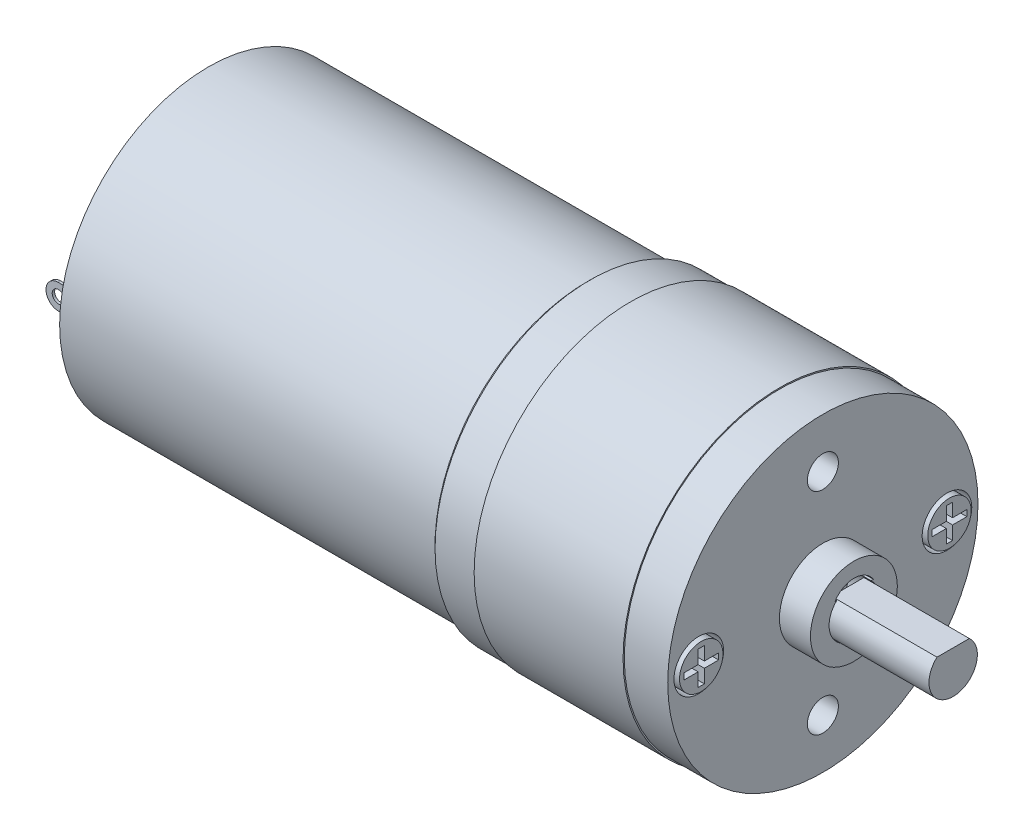
from build123d import *

# Parameters (mm, degrees)
SKETCH3_R               = 3.5
SKETCH3_R_2             = 2
BOSS_EXTRUDE1_DEPTH     = 2.5
BOSS_EXTRUDE2_START     = 2
SKETCH4_R               = 1.95
BOSS_EXTRUDE2_DEPTH     = 8.5
CUT_EXTRUDE1_DEPTH      = 10
CHAMFER1_SIZE           = 0.25
SKETCH6_R               = 2
CUT_EXTRUDE2_DEPTH      = 5
SKETCH7_R               = 1.75
BOSS_EXTRUDE3_DEPTH     = 5.2
CUT_EXTRUDE4_DEPTH      = 1
SKETCH9_R               = 1.25
CUT_EXTRUDE5_DEPTH      = 5
SKETCH11_W              = 0.2
SKETCH11_H              = 2
BOSS_EXTRUDE4_DEPTH     = 3
CUT_EXTRUDE6_START      = -20.2
CUT_EXTRUDE6_DEPTH      = 20.2
CUT_EXTRUDE7_DEPTH      = 55.812850986
CUT_EXTRUDE7_DEPTH_BACK = 55.812850986
SKETCH13_R              = 0.5


# Read off the part's stored shape, not the designer's step: Cut-Extrude6
with BuildPart() as part:
    # Sketch1 → Revolve1 (revolve)
    with BuildSketch(Plane.XY, mode=Mode.PRIVATE) as revolve1_sk:
        Polygon((-11.725797436, 0), (-11.725797436, 12), (18.774202564, 12), (18.774202564, 12.5), (22.274202564, 12.5), (22.274202564, 12.6), (34.274202564, 12.6), (34.274202564, 12.5), (37.774202564, 12.5), (37.774202564, 0), align=None)
    revolve(revolve1_sk.sketch.rotate(Axis((-11.725797436, 0, 0), (1, 0, 0)), 90), axis=Axis((-11.725797436, 0, 0), (1, 0, 0)))

    # Sketch3 → Boss-Extrude1 (add)
    with BuildSketch(Plane(origin=(37.774202564, 0, 0), x_dir=(0, 0, -1), z_dir=(1, 0, 0))):
        with Locations(Location((0, 0, 0), (0, 0, 180))):
            Circle(SKETCH3_R)
        Circle(SKETCH3_R_2, mode=Mode.SUBTRACT)
    extrude(amount=BOSS_EXTRUDE1_DEPTH)


with BuildPart() as body_2:
    # Sketch4 → Boss-Extrude2 (new body)
    with BuildSketch(Plane(origin=(37.774202564, 0, 0), x_dir=(0, 0, -1), z_dir=(1, 0, 0)).offset(BOSS_EXTRUDE2_START)):
        Circle(SKETCH4_R)
    extrude(amount=BOSS_EXTRUDE2_DEPTH)


with BuildPart() as cut_extrude1_tool:
    # Sketch5 → Cut-Extrude1 (new body)
    with BuildSketch(Plane(origin=(48.274202564, 0, 0), x_dir=(0, 0, -1), z_dir=(1, 0, 0))):
        with BuildLine():
            Line((0, 1.45), (1.563854219, 1.45))
            ThreePointArc((1.563854219, 1.45), (0.020575485, 2.299790468), (-1.52270325, 1.45))
            Line((-1.52270325, 1.45), (0, 1.45))
        make_face()
    extrude(amount=-CUT_EXTRUDE1_DEPTH)


with BuildPart() as part_1:
    add(part.part)

    # Cut-Extrude1: cut by cut_extrude1_tool
    add(cut_extrude1_tool.part, mode=Mode.SUBTRACT)

    # Chamfer1
    chamfer1_edges = [part_1.edges().sort_by_distance(p)[0] for p in [
        (18.774202564, 0, -12.5),
    ]]
    chamfer(chamfer1_edges, length=CHAMFER1_SIZE)

    # Sketch6 → Cut-Extrude2 (cut)
    with BuildSketch(Plane(origin=(37.774202564, 0, 0), x_dir=(0, 0, -1), z_dir=(1, 0, 0))):
        with Locations((10, 0)):
            Circle(SKETCH6_R)
        with Locations(Location((-10, 0, 0), (0, 0, 180))):
            Circle(SKETCH6_R)
    extrude(amount=-CUT_EXTRUDE2_DEPTH, mode=Mode.SUBTRACT)

    # Sketch7 → Boss-Extrude3 (add)
    with BuildSketch(Plane(origin=(32.774202564, 0, 0), x_dir=(0, 0, -1), z_dir=(1, 0, 0))):
        with Locations((10, 0)):
            Circle(SKETCH7_R)
        with Locations(Location((-10, 0, 0), (0, 0, 180))):
            Circle(SKETCH7_R)
    extrude(amount=BOSS_EXTRUDE3_DEPTH)

    # Sketch8 → Cut-Extrude4 (cut)
    with BuildSketch(Plane(origin=(37.974202564, 0, 0), x_dir=(0, 0, -1), z_dir=(1, 0, 0))):
        Polygon((8.594754122, -0.25), (8.594754122, 0.25), (9.75, 0.25), (9.75, 1.338286548), (10.25, 1.338286548), (10.25, 0.25), (11.405245878, 0.25), (11.405245878, -0.25), (10.25, -0.25), (10.25, -1.338286548), (9.75, -1.338286548), (9.75, -0.25), align=None)
        Polygon((-10.25, -0.25), (-11.405245878, -0.25), (-11.405245878, 0.25), (-10.25, 0.25), (-10.25, 1.338286548), (-9.75, 1.338286548), (-9.75, 0.25), (-8.594754122, 0.25), (-8.594754122, -0.25), (-9.75, -0.25), (-9.75, -1.338286548), (-10.25, -1.338286548), align=None)
    extrude(amount=-CUT_EXTRUDE4_DEPTH, mode=Mode.SUBTRACT)

    # Sketch9 → Cut-Extrude5 (cut)
    with BuildSketch(Plane(origin=(37.774202564, 0, 0), x_dir=(0, 0, -1), z_dir=(1, 0, 0))):
        with Locations((0, 8.5)):
            Circle(SKETCH9_R)
        with Locations(Location((0, -8.5, 0), (0, 0, 180))):
            Circle(SKETCH9_R)
    extrude(amount=-CUT_EXTRUDE5_DEPTH, mode=Mode.SUBTRACT)

    # Sketch11 → Boss-Extrude4 (add)
    with BuildSketch(Plane.ZY.offset(11.725797436)):
        with Locations((10, 0)):
            Rectangle(SKETCH11_W, SKETCH11_H)
        with Locations((-10, 0)):
            Rectangle(SKETCH11_W, SKETCH11_H)
    extrude(amount=BOSS_EXTRUDE4_DEPTH)

    # Cut-Extrude6 outline → Cut-Extrude6 (cut)
    with BuildSketch(Plane(origin=(0, 0, -10.1), x_dir=(-1, 0, 0), z_dir=(0, 0, -1)).offset(CUT_EXTRUDE6_START)):
        with BuildLine():
            ThreePointArc((13.765046185, 1), (14.446690478, 0.693369124), (14.725797436, 0))
            Line((14.725797436, 0), (14.725797436, 1))
            Line((14.725797436, 1), (13.765046185, 1))
        make_face()
        with BuildLine():
            ThreePointArc((14.725797436, 0), (14.446690478, -0.693369124), (13.765046185, -1))
            Line((13.765046185, -1), (14.725797436, -1))
            Line((14.725797436, -1), (14.725797436, 0))
        make_face()
    extrude(amount=CUT_EXTRUDE6_DEPTH, mode=Mode.SUBTRACT)

    # Sketch13 → Cut-Extrude7 (cut, two sides: drawn at the far end of the back side and taken through both)
    with BuildSketch(Plane(origin=(0, 0, -10.1), x_dir=(-1, 0, 0), z_dir=(0, 0, -1)).offset(-CUT_EXTRUDE7_DEPTH_BACK)):
        with Locations((13.724995738, 0)):
            Circle(SKETCH13_R)
    extrude(amount=CUT_EXTRUDE7_DEPTH + CUT_EXTRUDE7_DEPTH_BACK, mode=Mode.SUBTRACT)


with BuildPart() as body_2_1:
    add(body_2.part)

    # Cut-Extrude1: cut by cut_extrude1_tool
    add(cut_extrude1_tool.part, mode=Mode.SUBTRACT)


solid = Compound([part_1.part, body_2_1.part])
